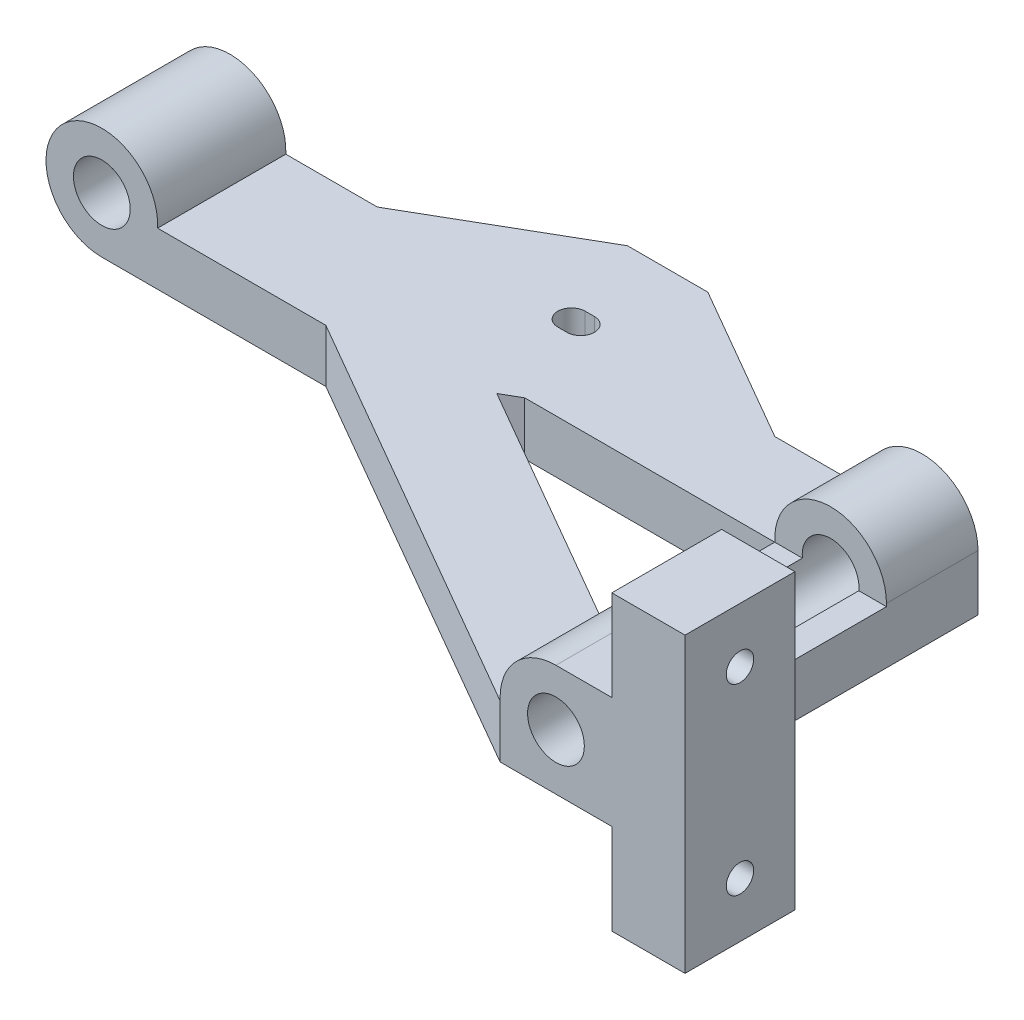
from build123d import *
from build123d.topology import SkipClean

# Parameters (mm, degrees)
SKETCH_2_R           = 3.05
SKETCH_2_R_2         = 1.55
EXTRUDE_1_DEPTH      = 25
CUT_EXTRUDE_3_DEPTH  = 74.430746455
SKETCH_8_R           = 1.6
CUT_EXTRUDE_4_DEPTH  = 0.8
CUT_EXTRUDE_START    = -2.895
CUT_EXTRUDE_10_DEPTH = 6.1
SKETCH_21_W          = 6
SKETCH_21_H          = 16
EXTRUDE_9_DEPTH      = 4
SKETCH_22_R          = 0.75
CUT_EXTRUDE_16_DEPTH = 4
CUT_EXTRUDE_19_DEPTH = 76.099311082
CUT_EXTRUDE_21_REACH = 87.974
SKETCH_25_W          = 9
SKETCH_25_H          = 3.205
CUT_EXTRUDE_22_REACH = 42.469
SKETCH_27_R          = 1.35
CUT_EXTRUDE_23_DEPTH = 2


# Read off the part's stored shape, not the designer's step: 切除-拉伸10
with BuildPart() as part:
    # 草图2 → 凸台-拉伸1 (new body)
    # profile 1 of 8: a face of its own
    with SkipClean():  # the faces are left unmerged after this step: merging them gives an invalid solid
        with BuildSketch(Plane.XY.offset(70)):
            with Locations((-18.9, 15.755)):
                Circle(SKETCH_2_R)
            with Locations((-18.9, 15.755)):
                Circle(SKETCH_2_R_2, mode=Mode.SUBTRACT)
        # profile 2 of 8: a face of its own
        with BuildSketch(Plane.XY.offset(70)):
            with BuildLine():
                Line((0, 12.705), (0, 15.6))
                Line((0, 15.6), (-15.853941071, 15.6))
                ThreePointArc((-15.853941071, 15.6), (-16.798839606, 13.544202633), (-18.9, 12.705))
                Line((-18.9, 12.705), (0, 12.705))
            make_face()
        # profile 3 of 8: a face of its own
        with BuildSketch(Plane.XY.offset(70)):
            with BuildLine():
                Line((15.853941071, 15.6), (0, 15.6))
                Line((0, 15.6), (0, 12.705))
                Line((0, 12.705), (18.9, 12.705))
                ThreePointArc((18.9, 12.705), (16.798839606, 13.544202633), (15.853941071, 15.6))
            make_face()
        # profile 4 of 8: a face of its own
        with BuildSketch(Plane.XY.offset(70)):
            with Locations((18.9, 15.755)):
                Circle(SKETCH_2_R)
            with Locations((18.9, 15.755)):
                Circle(SKETCH_2_R_2, mode=Mode.SUBTRACT)
        # profile 5 of 8: a face of its own
        with BuildSketch(Plane.XY.offset(70)):
            with BuildLine():
                Line((21.95, 18.805), (18.9, 18.805))
                ThreePointArc((18.9, 18.805), (21.056675683, 17.911675683), (21.95, 15.755))
                Line((21.95, 15.755), (21.95, 18.805))
            make_face()
        # profile 6 of 8: a face of its own
        with BuildSketch(Plane.XY.offset(70)):
            with BuildLine():
                ThreePointArc((18.9, 18.805), (16.689202633, 17.856160394), (15.853941071, 15.6))
                ThreePointArc((15.853941071, 15.6), (16.798839606, 13.544202633), (18.9, 12.705))
                Line((18.9, 12.705), (18.9, 14.205))
                ThreePointArc((18.9, 14.205), (17.35, 15.755), (18.9, 17.305))
                Line((18.9, 17.305), (18.9, 18.805))
            make_face()
        # profile 7 of 8: a face of its own
        with BuildSketch(Plane.XY.offset(70)):
            with BuildLine():
                Line((18.9, 14.205), (18.9, 12.705))
                ThreePointArc((18.9, 12.705), (21.056675683, 13.598324317), (21.95, 15.755))
                ThreePointArc((21.95, 15.755), (21.056675683, 17.911675683), (18.9, 18.805))
                Line((18.9, 18.805), (18.9, 17.305))
                ThreePointArc((18.9, 17.305), (19.996015511, 16.851015511), (20.45, 15.755))
                ThreePointArc((20.45, 15.755), (19.996015511, 14.658984489), (18.9, 14.205))
            make_face()
        # profile 8 of 8: a face of its own
        with BuildSketch(Plane.XY.offset(70)):
            with BuildLine():
                ThreePointArc((21.95, 15.755), (21.056675683, 13.598324317), (18.9, 12.705))
                Line((18.9, 12.705), (21.95, 12.705))
                Line((21.95, 12.705), (21.95, 15.755))
            make_face()
        extrude(amount=-EXTRUDE_1_DEPTH)

    # 草图7 → 切除-拉伸3 (cut, through all)
    with SkipClean():  # the faces are left unmerged after this step: merging them gives an invalid solid
        with BuildSketch(Plane(origin=(0, 15.6, 0), x_dir=(1, 0, 0), z_dir=(0, 1, 0))):
            with BuildLine():
                Line((0.25, -50.75), (-0.25, -50.75))
                ThreePointArc((-0.25, -50.75), (-1, -50), (-0.25, -49.25))
                Line((-0.25, -49.25), (0.25, -49.25))
                ThreePointArc((0.25, -49.25), (1, -50), (0.25, -50.75))
            make_face()
        extrude(amount=-CUT_EXTRUDE_3_DEPTH, mode=Mode.SUBTRACT)

    # 草图8 → 切除-拉伸4 (cut)
    with SkipClean():  # the faces are left unmerged after this step: merging them gives an invalid solid
        with BuildSketch(Plane.XZ.offset(-12.705)):
            with Locations((0, 50)):
                Circle(SKETCH_8_R)
        extrude(amount=-CUT_EXTRUDE_4_DEPTH, mode=Mode.SUBTRACT)

    # 切除-拉伸10 outline → 切除-拉伸10 (cut)
    with SkipClean():  # the faces are left unmerged after this step: merging them gives an invalid solid
        with BuildSketch(Plane(origin=(0, 15.6, 0), x_dir=(1, 0, 0), z_dir=(0, 1, 0)).offset(CUT_EXTRUDE_START)):
            Polygon((-6.666660498, -57), (-21.95, -57), (-21.95, -70), (15.85, -70), align=None)
            Polygon((-21.95, -50), (-10.853941071, -50), (-2.193687033, -45), (-21.95, -45), align=None)
            Polygon((10.853941071, -50), (21.95, -50), (21.95, -45), (2.193687033, -45), align=None)
        extrude(amount=CUT_EXTRUDE_10_DEPTH, mode=Mode.SUBTRACT)

    # 草图21 → 凸台-拉伸9 (add)
    with SkipClean():  # the faces are left unmerged after this step: merging them gives an invalid solid
        with BuildSketch(Plane(origin=(21.95, 0, 0), x_dir=(0, 0, -1), z_dir=(1, 0, 0))):
            with Locations((-67, 15.755)):
                Rectangle(SKETCH_21_W, SKETCH_21_H)
        extrude(amount=EXTRUDE_9_DEPTH)

    # 草图22 → 切除-拉伸16 (cut)
    with SkipClean():  # the faces are left unmerged after this step: merging them gives an invalid solid
        with BuildSketch(Plane(origin=(25.95, 0, 0), x_dir=(0, 0, -1), z_dir=(1, 0, 0))):
            with Locations((-67, 20.755)):
                Circle(SKETCH_22_R)
            with Locations((-67, 10.755)):
                Circle(SKETCH_22_R)
        extrude(amount=-CUT_EXTRUDE_16_DEPTH, mode=Mode.SUBTRACT)

    # 草图23 → 切除-拉伸19 (cut, through all)
    with SkipClean():  # the faces are left unmerged after this step: merging them gives an invalid solid
        with BuildSketch(Plane(origin=(0, 15.6, 0), x_dir=(1, 0, 0), z_dir=(0, 1, 0))):
            Polygon((1.227614882, -55.557762016), (15.85, -64), (15.85, -55), (2.193687033, -55), align=None)
        extrude(amount=-CUT_EXTRUDE_19_DEPTH, mode=Mode.SUBTRACT)

    # 草图25 → 切除-拉伸21 (cut, up to next)
    with BuildSketch(Plane(origin=(21.95, 0, 0), x_dir=(0, 0, -1), z_dir=(1, 0, 0)), mode=Mode.PRIVATE) as cut_extrude_21_sk1:
        with Locations((-59.5, 17.2025)):
            Rectangle(SKETCH_25_W, SKETCH_25_H)
    cut_extrude_21_tool1 = extrude(cut_extrude_21_sk1.sketch, amount=-CUT_EXTRUDE_21_REACH, mode=Mode.PRIVATE) & part.part
    add(cut_extrude_21_tool1.solids().sort_by_distance((21.95, 17.2025, 59.5))[0], mode=Mode.SUBTRACT)

    # 草图26 → 切除-拉伸22 (cut, up to next)
    with BuildSketch(Plane(origin=(0, 0, 50), x_dir=(-1, 0, 0), z_dir=(0, 0, -1)), mode=Mode.PRIVATE) as cut_extrude_22_sk1:
        with BuildLine():
            ThreePointArc((-21.95, 15.755), (-21.056675683, 17.911675683), (-18.9, 18.805))
            Line((-18.9, 18.805), (-21.95, 18.805))
            Line((-21.95, 18.805), (-21.95, 15.755))
        make_face()
    cut_extrude_22_tool1 = extrude(cut_extrude_22_sk1.sketch, amount=-CUT_EXTRUDE_22_REACH, mode=Mode.PRIVATE) & part.part
    add(cut_extrude_22_tool1.solids().sort_by_distance((21.268728, 18.123728, 50))[0], mode=Mode.SUBTRACT)

    # 草图27 → 切除-拉伸23 (cut)
    with SkipClean():  # the faces are left unmerged after this step: merging them gives an invalid solid
        with BuildSketch(Plane.ZY.offset(-21.95)):
            with Locations((67, 20.755)):
                Circle(SKETCH_27_R)
            with Locations((67, 10.755)):
                Circle(SKETCH_27_R)
        extrude(amount=-CUT_EXTRUDE_23_DEPTH, mode=Mode.SUBTRACT)


solid = part.part
